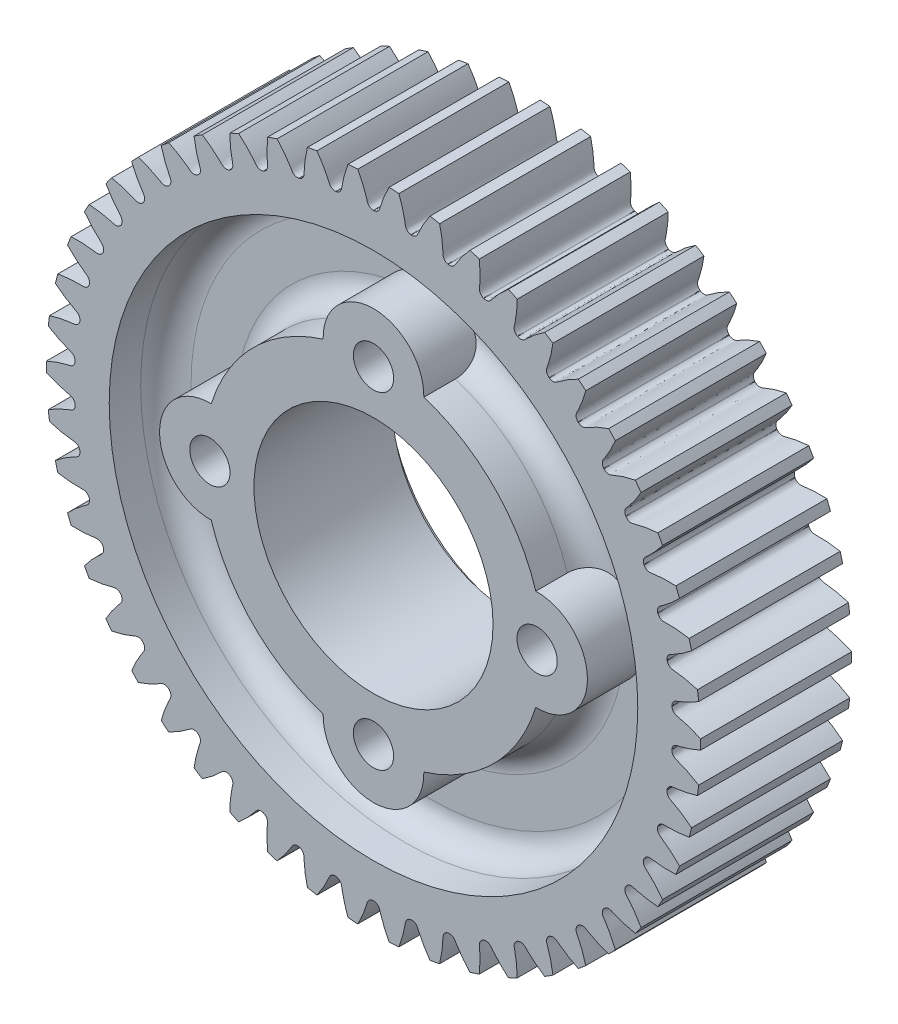
from build123d import *

# Parameters (mm, degrees)
SKETCH_1_R               = 26
EXTRUDE_1_DEPTH          = 12
CUT_EXTRUDE_1_DEPTH      = 39.678159212
PATTERN_CIRCULAR_1_COUNT = 50
SKETCH_4_R               = 9.5
CUT_EXTRUDE_2_DEPTH      = 12
SKETCH_5_R               = 1.6
CUT_EXTRUDE_3_DEPTH      = 12
PATTERN_CIRCULAR_2_COUNT = 4
SKETCH_6_R               = 10.75
CUT_EXTRUDE_4_DEPTH      = 1
SKETCH_7_R               = 21
CUT_EXTRUDE_5_DEPTH      = 4.5
FILLET_1_R               = 2


with BuildPart() as part:
    # 草图1 → 凸台-拉伸1 (new body)
    with BuildSketch(Plane.XY):
        Circle(SKETCH_1_R)
    extrude(amount=EXTRUDE_1_DEPTH)

    # 草图2 → 切除-拉伸1 (cut, through all)
    with BuildSketch(Plane.XY):
        with BuildLine():
            ThreePointArc((0.018256116, 23.749992983), (0, 23.75), (-0.018256116, 23.749992983))
            add(Edge.make_bspline(
                [(-0.018256116, 23.749992983), (-0.43502677, 23.80092954), (-0.488263226, 24.115542193), (-0.594784579, 24.458759502), (-0.638691863, 24.592940563), (-0.688543951, 24.734989822), (-0.744462101, 24.884847093), (-0.806838984, 25.04228552), (-0.875980734, 25.207114204), (-0.952211703, 25.379118875), (-1.035843516, 25.558079403), (-1.127183732, 25.7437649), (-1.226532997, 25.935935337), (-1.334185536, 26.134341284), (-1.45042869, 26.338724199), (-1.575542725, 26.548816571), (-1.709800577, 26.76434211), (-1.853467615, 26.98501593), (-2.006801408, 27.210544746), (-2.170051494, 27.440627072), (-2.343459158, 27.674953425), (-2.527257213, 27.913206537), (-2.721669781, 28.155061571), (-2.926912106, 28.400186342), (-3.143190259, 28.648241548), (-3.450749097, 28.987066304), (-3.692335855, 29.23747667), (-3.858794071, 29.403429001)],
                knots=[0, 0, 0, 0, 0.116496199, 0.135538346, 0.15593866, 0.177697141, 0.200813789, 0.225288605, 0.251121587, 0.278312737, 0.306862053, 0.336769537, 0.368035188, 0.400659005, 0.43464099, 0.469981142, 0.506679462, 0.544735948, 0.584150601, 0.624923421, 0.667054409, 0.710543564, 0.755390885, 0.801596374, 0.84916003, 0.898081853, 1, 1, 1, 1], degree=3))
            ThreePointArc((-3.858794071, 29.403429001), (0, 29.65555477), (3.858794071, 29.403429001))
            add(Edge.make_bspline(
                [(0.018256116, 23.749992983), (0.43502677, 23.80092954), (0.488263226, 24.115542193), (0.594784579, 24.458759502), (0.638691863, 24.592940563), (0.688543951, 24.734989822), (0.744462101, 24.884847093), (0.806838984, 25.04228552), (0.875980734, 25.207114204), (0.952211703, 25.379118875), (1.035843516, 25.558079403), (1.127183732, 25.7437649), (1.226532997, 25.935935337), (1.334185536, 26.134341284), (1.45042869, 26.338724199), (1.575542725, 26.548816571), (1.709800577, 26.76434211), (1.853467615, 26.98501593), (2.006801408, 27.210544746), (2.170051494, 27.440627072), (2.343459158, 27.674953425), (2.527257213, 27.913206537), (2.721669781, 28.155061571), (2.926912106, 28.400186342), (3.143190259, 28.648241548), (3.450749097, 28.987066304), (3.692335855, 29.23747667), (3.858794071, 29.403429001)],
                knots=[0, 0, 0, 0, 0.116496199, 0.135538346, 0.15593866, 0.177697141, 0.200813789, 0.225288605, 0.251121587, 0.278312737, 0.306862053, 0.336769537, 0.368035188, 0.400659005, 0.43464099, 0.469981142, 0.506679462, 0.544735948, 0.584150601, 0.624923421, 0.667054409, 0.710543564, 0.755390885, 0.801596374, 0.84916003, 0.898081853, 1, 1, 1, 1], degree=3))
        make_face()
    cut_extrude_1 = extrude(amount=CUT_EXTRUDE_1_DEPTH, mode=Mode.SUBTRACT)

    # 阵列(圆周)1: 切除-拉伸1 ×50 about axis
    pattern_circular_1_axis = Axis((0, 0, 12), (0, 0, -1))
    for i in range(1, PATTERN_CIRCULAR_1_COUNT):
        add(cut_extrude_1.rotate(pattern_circular_1_axis, i * 360 / PATTERN_CIRCULAR_1_COUNT), mode=Mode.SUBTRACT)

    # 草图4 → 切除-拉伸2 (cut)
    with BuildSketch(Plane.XY.offset(12)):
        Circle(SKETCH_4_R)
    extrude(amount=-CUT_EXTRUDE_2_DEPTH, mode=Mode.SUBTRACT)

    # 草图5 → 切除-拉伸3 (cut)
    with BuildSketch(Plane.XY.offset(12)):
        with Locations((0, 13)):
            Circle(SKETCH_5_R)
    cut_extrude_3 = extrude(amount=-CUT_EXTRUDE_3_DEPTH, mode=Mode.SUBTRACT)

    # 阵列(圆周)2: 切除-拉伸3 ×4 about axis
    pattern_circular_2_axis = Axis((0, 0, 0), (0, 0, 1))
    for i in range(1, PATTERN_CIRCULAR_2_COUNT):
        add(cut_extrude_3.rotate(pattern_circular_2_axis, i * 360 / PATTERN_CIRCULAR_2_COUNT), mode=Mode.SUBTRACT)

    # 草图6 → 切除-拉伸4 (cut)
    with BuildSketch(Plane(origin=(0, 0, 0), x_dir=(-1, 0, 0), z_dir=(0, 0, -1))):
        Circle(SKETCH_6_R)
    extrude(amount=-CUT_EXTRUDE_4_DEPTH, mode=Mode.SUBTRACT)

    # 草图7 → 切除-拉伸5 (cut)
    with BuildSketch(Plane.XY.offset(12)):
        Circle(SKETCH_7_R)
        with BuildLine():
            ThreePointArc((-3.998601364, 12.894230769), (-9.545941546, 9.545941546), (-12.894230769, 3.998601364))
            ThreePointArc((-12.894230769, 3.998601364), (-17, 0), (-12.894230769, -3.998601364))
            ThreePointArc((-12.894230769, -3.998601364), (-9.545941546, -9.545941546), (-3.998601364, -12.894230769))
            ThreePointArc((-3.998601364, -12.894230769), (0, -17), (3.998601364, -12.894230769))
            ThreePointArc((3.998601364, -12.894230769), (9.545941546, -9.545941546), (12.894230769, -3.998601364))
            ThreePointArc((12.894230769, -3.998601364), (17, 0), (12.894230769, 3.998601364))
            ThreePointArc((12.894230769, 3.998601364), (9.545941546, 9.545941546), (3.998601364, 12.894230769))
            ThreePointArc((3.998601364, 12.894230769), (0, 17), (-3.998601364, 12.894230769))
        make_face(mode=Mode.SUBTRACT)
    cut_extrude_5 = extrude(amount=-CUT_EXTRUDE_5_DEPTH, mode=Mode.SUBTRACT)

    # 镜向1: 切除-拉伸5 across plane
    add(cut_extrude_5.mirror(Plane.XY.offset(6)), mode=Mode.SUBTRACT)

    # 圆角1
    fillet_1_edges = [part.edges().sort_by_distance(p)[0] for p in [
        (-21, 0, 7.5),
        (-9.545941546, -9.545941546, 7.5),
        (9.545941546, -9.545941546, 7.5),
        (9.545941546, 9.545941546, 7.5),
        (-9.545941546, 9.545941546, 7.5),
        (-21, 0, 4.5),
        (-9.545941546, -9.545941546, 4.5),
        (9.545941546, -9.545941546, 4.5),
        (9.545941546, 9.545941546, 4.5),
        (-9.545941546, 9.545941546, 4.5),
    ]]
    fillet(fillet_1_edges, radius=FILLET_1_R)


solid = part.part
